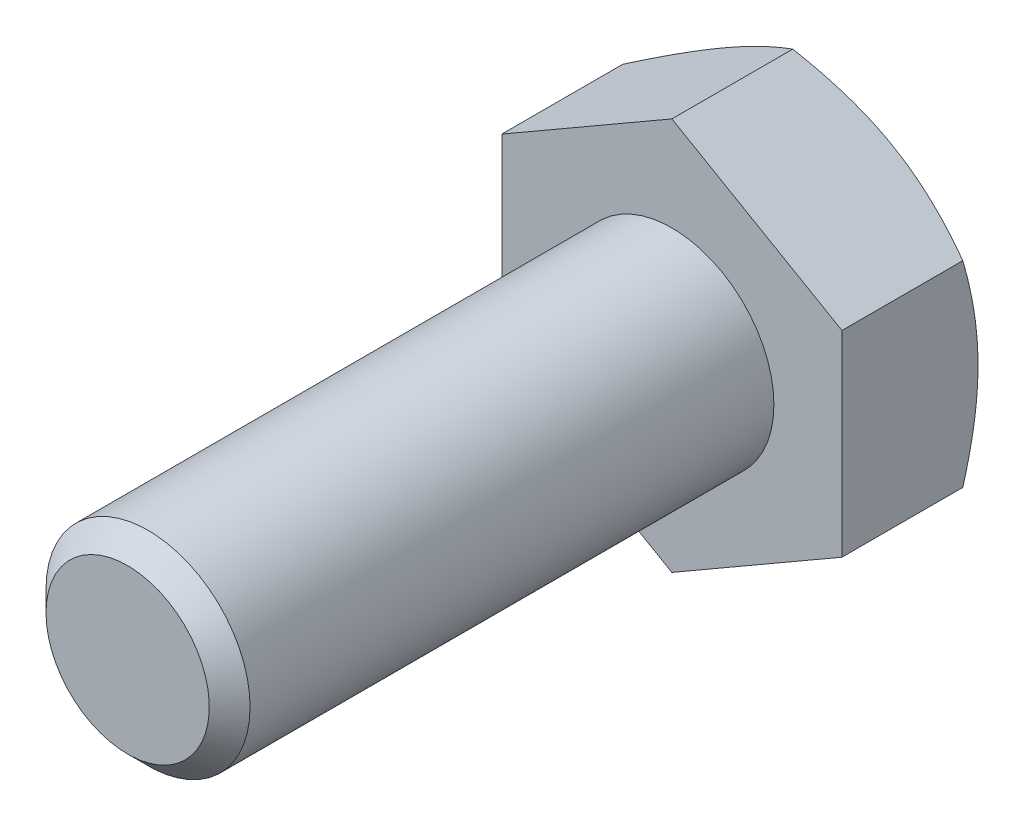
from build123d import *

# Parameters (mm, degrees)
ESQUISSE1_W        = 3
ESQUISSE1_H        = 16
BOSS_EXTRU_1_DEPTH = 4


with BuildPart() as part:
    # Esquisse1 → Base-Révolution (revolve)
    with BuildSketch(Plane(origin=(0, 0, 0), x_dir=(1, 0, 0), z_dir=(0, 1, 0))):
        with Locations((1.5, -8)):
            Rectangle(ESQUISSE1_W, ESQUISSE1_H)
    revolve(axis=Axis((0, 0, 0), (0, 0, 1)))

    # Chanfrein1: read off the stored shape, not the designer's step
    # Chanfrein1 outline → Chanfrein1 (revolve, cut)
    with BuildSketch(Plane.XZ):
        Polygon((3, 16), (2.4, 16), (3, 15.4), align=None)
    revolve(axis=Axis((0, 0, 0), (0, 0, 1)), mode=Mode.SUBTRACT)

    # Esquisse6 → Boss.-Extru.1 (add)
    with BuildSketch(Plane.XY):
        Polygon((5, -2.886751346), (5, 2.886751346), (0, 5.773502692), (-5, 2.886751346), (-5, -2.886751346), (0, -5.773502692), align=None)
    extrude(amount=-BOSS_EXTRU_1_DEPTH)

    # Esquisse7 → Enlèvement de matière-Révolution1 (revolve, cut)
    with BuildSketch(Plane(origin=(0, 0, 0), x_dir=(1, 0, 0), z_dir=(0, 1, 0))):
        Polygon((-5, 4), (-11.92820323, 4), (-11.92820323, 0), align=None)
    revolve(axis=Axis((0, 0, -6.239446496), (0, 0, 1)), mode=Mode.SUBTRACT)


solid = part.part
